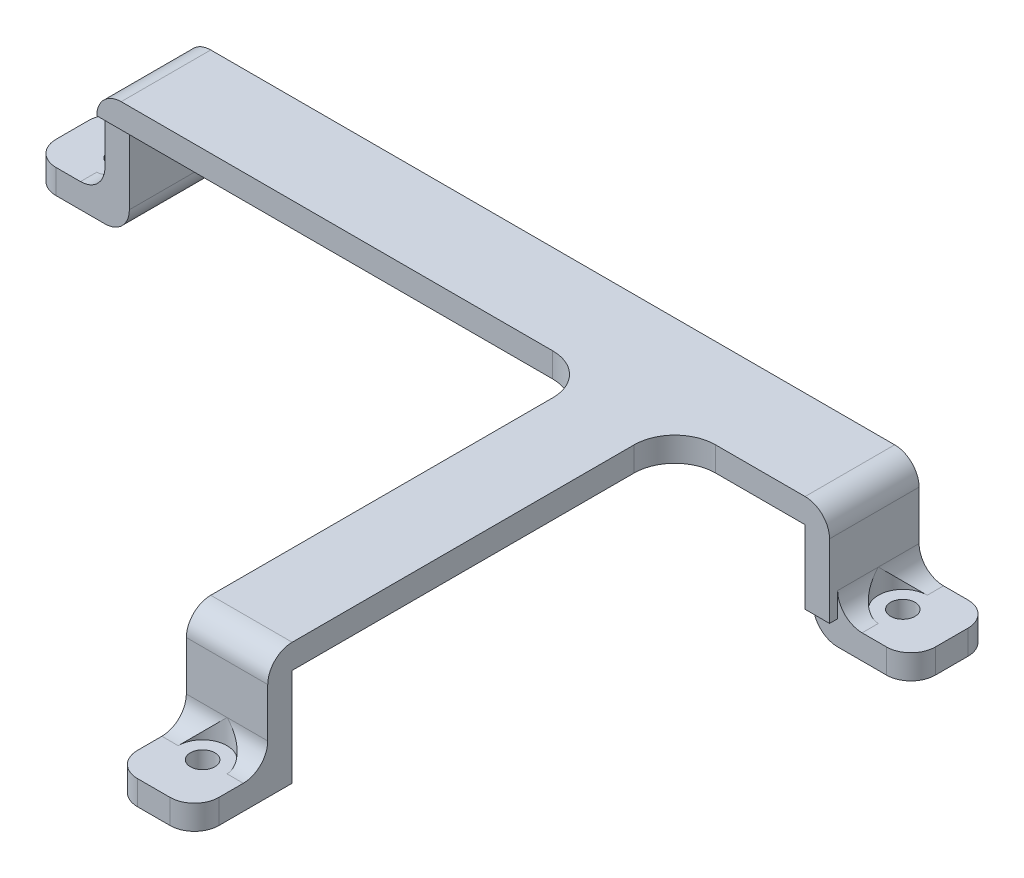
from build123d import *

# Parameters (mm, degrees)
SKETCH1_W               = 12
SKETCH1_H               = 10
SKETCH1_R               = 1.5
SCREW_TABS_DEPTH        = 3
SCREW_TABS_2_DEPTH      = 3
SKETCH1_W_2             = 10
SKETCH1_H_2             = 12
SCREW_TABS_3_DEPTH      = 3
SKETCH2_W               = 3
SKETCH2_H               = 10
SKETCH2_H_2             = 11
SKETCH2_W_2             = 10
SKETCH2_H_3             = 3
VERTICAL_EXTRUDE_DEPTH  = 9
TOP_BRACKET_DEPTH       = 3
F_3MM_EDGE_ROUNDING_R   = 3
SKETCH4_R               = 3
SCREWHOLE_CLEARUP_DEPTH = 100.322706431


with BuildPart() as part:
    # Sketch1 → Screw tabs (new body)
    with BuildSketch(Plane(origin=(0, 0, 0), x_dir=(1, 0, 0), z_dir=(0, 1, 0))):
        with Locations((-69, 59)):
            Rectangle(SKETCH1_W, SKETCH1_H)
        with Locations(Location((-69, 59, 0), (0, 0, 270))):
            Circle(SKETCH1_R, mode=Mode.SUBTRACT)
    extrude(amount=SCREW_TABS_DEPTH)



with BuildPart() as body_2:
    # Sketch1 → Screw tabs 2 (new body)
    with BuildSketch(Plane(origin=(0, 0, 0), x_dir=(1, 0, 0), z_dir=(0, 1, 0))):
        with Locations((27, 59)):
            Rectangle(SKETCH1_W, SKETCH1_H)
        with Locations(Location((27, 59, 0), (0, 0, 270))):
            Circle(SKETCH1_R, mode=Mode.SUBTRACT)
    extrude(amount=SCREW_TABS_2_DEPTH)


with BuildPart() as body_3:
    # Sketch1 → Screw tabs 3 (new body)
    with BuildSketch(Plane(origin=(0, 0, 0), x_dir=(1, 0, 0), z_dir=(0, 1, 0))):
        Rectangle(SKETCH1_W_2, SKETCH1_H_2)
        with Locations(Location((0, 0, 0), (0, 0, 270))):
            Circle(SKETCH1_R, mode=Mode.SUBTRACT)
    extrude(amount=SCREW_TABS_3_DEPTH)


with BuildPart() as part_1:
    add(part.part)

    add(body_2.part)  # Vertical extrude merges body 2

    add(body_3.part)  # Vertical extrude merges body 3
    # Sketch2 → Vertical extrude (add)
    with BuildSketch(Plane(origin=(0, 3, 0), x_dir=(1, 0, 0), z_dir=(0, 1, 0))):
        with Locations((-64.5, 59)):
            Rectangle(SKETCH2_W, SKETCH2_H)
        with Locations((22.5, 58.5)):
            Rectangle(SKETCH2_W, SKETCH2_H_2)
        with Locations((0, 4.5)):
            Rectangle(SKETCH2_W_2, SKETCH2_H_3)
    extrude(amount=VERTICAL_EXTRUDE_DEPTH)

    # Sketch3 → Top bracket (add)
    with BuildSketch(Plane(origin=(0, 12, 0), x_dir=(1, 0, 0), z_dir=(0, 1, 0))):
        with BuildLine():
            Line((-66, 64), (24, 64))
            Line((24, 64), (24, 53))
            Line((24, 53), (10, 53))
            ThreePointArc((10, 53), (6.464466094, 51.535533906), (5, 48))
            Line((5, 48), (5, 3))
            Line((5, 3), (-5, 3))
            Line((-5, 3), (-5, 48))
            ThreePointArc((-5, 48), (-6.464466094, 51.535533906), (-10, 53))
            Line((-10, 53), (-66, 53))
            Line((-66, 53), (-66, 64))
        make_face()
    extrude(amount=TOP_BRACKET_DEPTH)

    # 3mm edge rounding
    # the kernel refuses this fillet: 3 mm, written as the material it adds along each edge
    with BuildSketch(Plane(origin=(24, 3, -64), x_dir=(1, 0, 0), z_dir=(0, 0, 1))) as f_3mm_edge_rounding_piece_1_section:
        with BuildLine():
            CenterArc((F_3MM_EDGE_ROUNDING_R, F_3MM_EDGE_ROUNDING_R), F_3MM_EDGE_ROUNDING_R, 180, 90)
            Line((0, F_3MM_EDGE_ROUNDING_R), (0, 0))
            Line((0, 0), (F_3MM_EDGE_ROUNDING_R, 0))
        make_face()
    f_3mm_edge_rounding_piece_1 = extrude(amount=10, mode=Mode.PRIVATE)
    f_3mm_edge_rounding_piece_1 = f_3mm_edge_rounding_piece_1 - Plane(origin=(27, 3.680423694, -59), x_dir=(0, 0, 1), z_dir=(0, -1, 0)) * Cylinder(1.5, 33, mode=Mode.PRIVATE)
    add(f_3mm_edge_rounding_piece_1)
    with BuildSketch(Plane(origin=(5, 3, -3), x_dir=(0, 0, 1), z_dir=(-1, 0, 0))) as f_3mm_edge_rounding_piece_2_section:
        with BuildLine():
            CenterArc((F_3MM_EDGE_ROUNDING_R, F_3MM_EDGE_ROUNDING_R), F_3MM_EDGE_ROUNDING_R, 180, 90)
            Line((0, F_3MM_EDGE_ROUNDING_R), (0, 0))
            Line((0, 0), (F_3MM_EDGE_ROUNDING_R, 0))
        make_face()
    f_3mm_edge_rounding_piece_2 = extrude(amount=10, mode=Mode.PRIVATE)
    f_3mm_edge_rounding_piece_2 = f_3mm_edge_rounding_piece_2 - Plane(origin=(0, 3.680423694, 0), x_dir=(0, 0, 1), z_dir=(0, -1, 0)) * Cylinder(1.5, 32, mode=Mode.PRIVATE)
    add(f_3mm_edge_rounding_piece_2)
    with BuildSketch(Plane(origin=(-66, 3, -64), x_dir=(0, 1, 0), z_dir=(0, 0, 1))) as f_3mm_edge_rounding_piece_3_section:
        with BuildLine():
            CenterArc((F_3MM_EDGE_ROUNDING_R, F_3MM_EDGE_ROUNDING_R), F_3MM_EDGE_ROUNDING_R, 180, 90)
            Line((0, F_3MM_EDGE_ROUNDING_R), (0, 0))
            Line((0, 0), (F_3MM_EDGE_ROUNDING_R, 0))
        make_face()
    f_3mm_edge_rounding_piece_3 = extrude(amount=10, mode=Mode.PRIVATE)
    f_3mm_edge_rounding_piece_3 = f_3mm_edge_rounding_piece_3 - Plane(origin=(-69, 3.680423205, -59), x_dir=(0, 0, 1), z_dir=(0, -1, 0)) * Cylinder(1.5, 32, mode=Mode.PRIVATE)
    add(f_3mm_edge_rounding_piece_3)
    # the kernel refuses this fillet: 3 mm, written as the material it takes off along each edge
    with BuildSketch(Plane(origin=(-63, 0, -71.5), x_dir=(0, 1, 0), z_dir=(0, 0, 1)), Plane(origin=(21, 0, -46.5), x_dir=(0, 1, 0), z_dir=(0, 0, -1))) as f_3mm_edge_rounding_2_piece_1:
        with BuildLine():
            CenterArc((F_3MM_EDGE_ROUNDING_R, F_3MM_EDGE_ROUNDING_R), F_3MM_EDGE_ROUNDING_R, 180, 90)
            Line((0, F_3MM_EDGE_ROUNDING_R), (0, 0))
            Line((0, 0), (F_3MM_EDGE_ROUNDING_R, 0))
        make_face()
    extrude(amount=25, mode=Mode.SUBTRACT)
    with BuildSketch(Plane(origin=(33, -7.5, -64), x_dir=(-1, 0, 0), z_dir=(0, 1, 0)), Plane(origin=(5, -7.5, 6), x_dir=(0, 0, -1), z_dir=(0, 1, 0)), Plane(origin=(-75, -7.5, -54), x_dir=(1, 0, 0), z_dir=(0, 1, 0))) as f_3mm_edge_rounding_2_piece_2:
        with BuildLine():
            CenterArc((F_3MM_EDGE_ROUNDING_R, F_3MM_EDGE_ROUNDING_R), F_3MM_EDGE_ROUNDING_R, 180, 90)
            Line((0, F_3MM_EDGE_ROUNDING_R), (0, 0))
            Line((0, 0), (F_3MM_EDGE_ROUNDING_R, 0))
        make_face()
    extrude(amount=18, mode=Mode.SUBTRACT)
    with BuildSketch(Plane(origin=(33, -7.5, -54), x_dir=(-1, 0, 0), z_dir=(0, 1, 0)), Plane(origin=(-5, -7.5, 6), x_dir=(0, 0, -1), z_dir=(0, 1, 0)), Plane(origin=(-75, -7.5, -64), x_dir=(1, 0, 0), z_dir=(0, 1, 0))) as f_3mm_edge_rounding_2_piece_3:
        with BuildLine():
            CenterArc((F_3MM_EDGE_ROUNDING_R, -F_3MM_EDGE_ROUNDING_R), F_3MM_EDGE_ROUNDING_R, 90, 90)
            Line((0, -F_3MM_EDGE_ROUNDING_R), (0, 0))
            Line((0, 0), (F_3MM_EDGE_ROUNDING_R, 0))
        make_face()
    extrude(amount=18, mode=Mode.SUBTRACT)
    with BuildSketch(Plane(origin=(24, 15, -71.5), x_dir=(-1, 0, 0), z_dir=(0, 0, 1)), Plane(origin=(-66, 15, -45.5), x_dir=(1, 0, 0), z_dir=(0, 0, -1))) as f_3mm_edge_rounding_2_piece_4:
        with BuildLine():
            CenterArc((F_3MM_EDGE_ROUNDING_R, F_3MM_EDGE_ROUNDING_R), F_3MM_EDGE_ROUNDING_R, 180, 90)
            Line((0, F_3MM_EDGE_ROUNDING_R), (0, 0))
            Line((0, 0), (F_3MM_EDGE_ROUNDING_R, 0))
        make_face()
    extrude(amount=26, mode=Mode.SUBTRACT)
    with BuildSketch(Plane(origin=(12.5, 15, -3), x_dir=(0, -1, 0), z_dir=(-1, 0, 0))) as f_3mm_edge_rounding_2_piece_5:
        with BuildLine():
            CenterArc((F_3MM_EDGE_ROUNDING_R, -F_3MM_EDGE_ROUNDING_R), F_3MM_EDGE_ROUNDING_R, 90, 90)
            Line((0, -F_3MM_EDGE_ROUNDING_R), (0, 0))
            Line((0, 0), (F_3MM_EDGE_ROUNDING_R, 0))
        make_face()
    extrude(amount=25, mode=Mode.SUBTRACT)

    # Sketch4 → Screwhole clearup (cut, through all)
    with BuildSketch(Plane(origin=(0, 3, 0), x_dir=(1, 0, 0), z_dir=(0, 1, 0))):
        with Locations((-69, 59)):
            Circle(SKETCH4_R)
        Circle(SKETCH4_R)
        with Locations((27, 59)):
            Circle(SKETCH4_R)
    extrude(amount=SCREWHOLE_CLEARUP_DEPTH, mode=Mode.SUBTRACT)


solid = part_1.part
